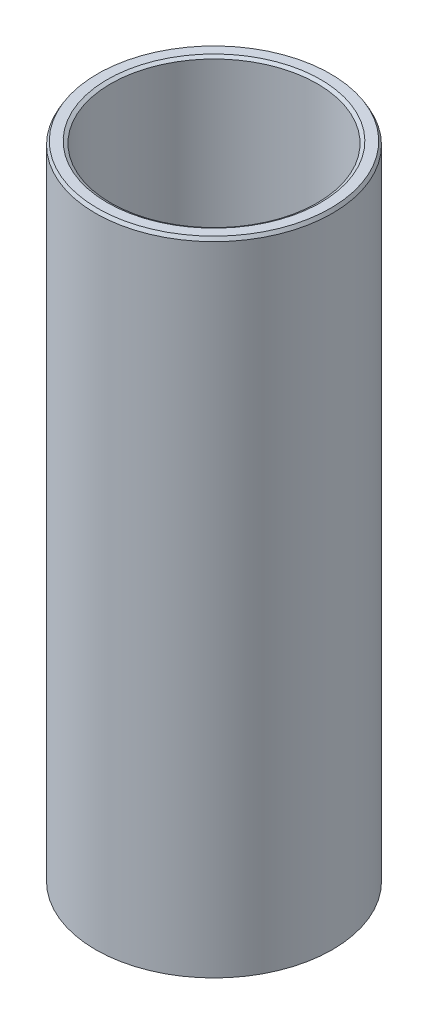
from build123d import *
from OCP.BRepFilletAPI import BRepFilletAPI_MakeChamfer

# Parameters (mm, degrees)
SKETCH1_R           = 47.5
BOSS_EXTRUDE1_DEPTH = 257.852960357
SKETCH2_R           = 41.425095424
CUT_EXTRUDE1_DEPTH  = 267.459470023
CHAMFER1_SIZE       = 1.355633495
CHAMFER1_SIZE2      = 0.782675363


with BuildPart() as part:
    # Sketch1 → Boss-Extrude1 (new body)
    with BuildSketch(Plane(origin=(0, 0, 0), x_dir=(1, 0, 0), z_dir=(0, 1, 0))):
        Circle(SKETCH1_R)
    extrude(amount=BOSS_EXTRUDE1_DEPTH)

    # Sketch2 → Cut-Extrude1 (cut, through all)
    with BuildSketch(Plane(origin=(0, 0, 0), x_dir=(1, 0, 0), z_dir=(0, 1, 0))):
        Circle(SKETCH2_R)
    extrude(amount=CUT_EXTRUDE1_DEPTH, mode=Mode.SUBTRACT)

    # Chamfer1: one chamfer whose edges measure the first distance from different faces: ONE call of the kernel's chamfer builder (chamfer() names one face for all edges)
    chamfer1_edges_1 = [part.edges().sort_by_distance(p)[0] for p in [
        (-41.425095424, 257.852960357, 0),
    ]]
    chamfer1_side_1 = [part.faces().sort_by_distance(p)[0] for p in [
        (-46.156497116, 257.852960357, 0),
    ]]
    chamfer1_edges_2 = [part.edges().sort_by_distance(p)[0] for p in [
        (-41.425095424, 0, 0),
    ]]
    chamfer1_side_2 = [part.faces().sort_by_distance(p)[0] for p in [
        (-41.425095424, 128.926480179, 0),
    ]]
    chamfer1_edges_3 = [part.edges().sort_by_distance(p)[0] for p in [
        (-47.5, 0, 0),
    ]]
    chamfer1_side_3 = [part.faces().sort_by_distance(p)[0] for p in [
        (-46.156497116, 0, 0),
    ]]
    chamfer1_edges_4 = [part.edges().sort_by_distance(p)[0] for p in [
        (-47.5, 257.852960357, 0),
    ]]
    chamfer1_side_4 = [part.faces().sort_by_distance(p)[0] for p in [
        (-47.5, 128.926480179, 0),
    ]]
    chamfer1 = BRepFilletAPI_MakeChamfer(part.part.solid().wrapped)
    for e in chamfer1_edges_1:
        chamfer1.Add(CHAMFER1_SIZE, CHAMFER1_SIZE2, e.wrapped, chamfer1_side_1[0].wrapped)  # the first distance lies on this face
    for e in chamfer1_edges_2:
        chamfer1.Add(CHAMFER1_SIZE, CHAMFER1_SIZE2, e.wrapped, chamfer1_side_2[0].wrapped)  # the first distance lies on this face
    for e in chamfer1_edges_3:
        chamfer1.Add(CHAMFER1_SIZE, CHAMFER1_SIZE2, e.wrapped, chamfer1_side_3[0].wrapped)  # the first distance lies on this face
    for e in chamfer1_edges_4:
        chamfer1.Add(CHAMFER1_SIZE, CHAMFER1_SIZE2, e.wrapped, chamfer1_side_4[0].wrapped)  # the first distance lies on this face
    add(Compound.cast(chamfer1.Shape()), mode=Mode.REPLACE)


solid = part.part
